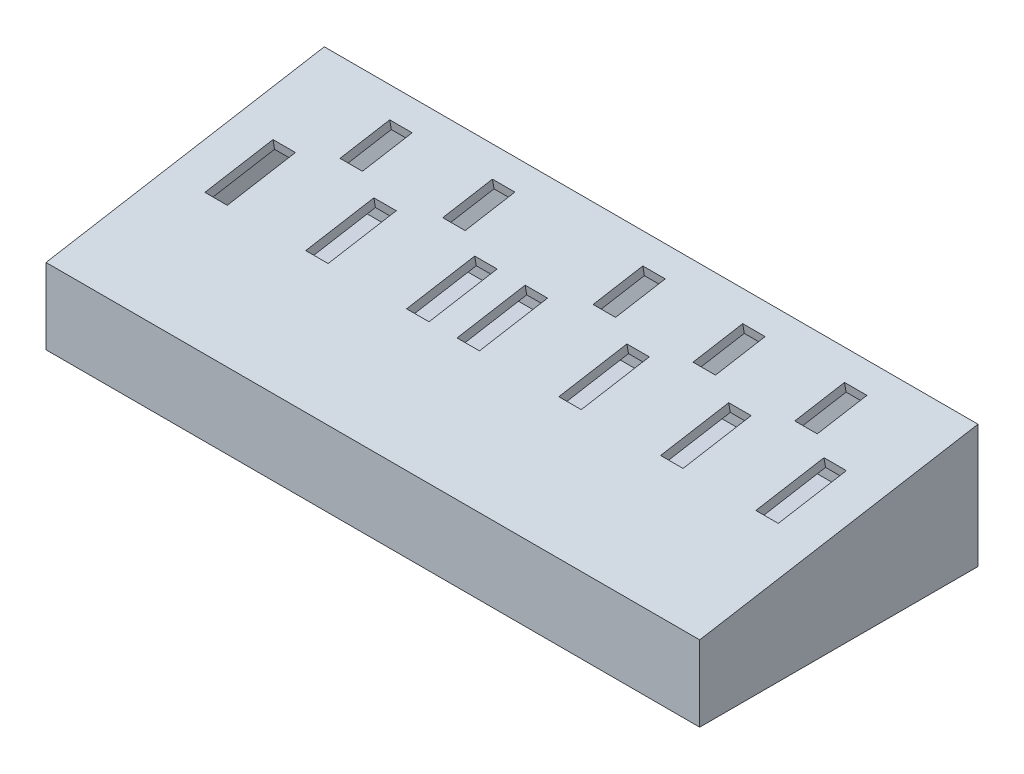
from build123d import *

# Parameters (mm, degrees)
CROQUIS1_W              = 700
CROQUIS1_H              = 298
SALIENTE_EXTRUIR1_DEPTH = 132
CORTAR_EXTRUIR1_DEPTH   = 773.158014917
CROQUIS5_W              = 24
CROQUIS5_H              = 74
CROQUIS5_H_2            = 54
CORTAR_EXTRUIR2_DEPTH   = 10
VACIADO2_START          = 10
VACIADO2_DEPTH          = 680


# Read off the part's stored shape, not the designer's step: Vaciado2
with BuildPart() as part:
    # Croquis1 → Saliente-Extruir1 (new body)
    with BuildSketch(Plane(origin=(0, 0, 0), x_dir=(1, 0, 0), z_dir=(0, 1, 0))):
        with Locations((350, 149)):
            Rectangle(CROQUIS1_W, CROQUIS1_H)
    extrude(amount=SALIENTE_EXTRUIR1_DEPTH)

    # Croquis3 → Cortar-Extruir1 (cut, through all)
    with BuildSketch(Plane.ZY):
        Polygon((0, 81), (-298, 132), (0, 132), align=None)
    extrude(amount=-CORTAR_EXTRUIR1_DEPTH, mode=Mode.SUBTRACT)

    # Croquis5 → Cortar-Extruir2 (cut)
    with BuildSketch(Plane(origin=(0, 78.695082326, 13.467950331), x_dir=(1, 0, 0), z_dir=(0, 0.9856694305119892, 0.16868839247017262))):
        with Locations((54, 180.66375979)):
            Rectangle(CROQUIS5_W, CROQUIS5_H)
        with Locations((162, 180.66375979)):
            Rectangle(CROQUIS5_W, CROQUIS5_H)
        with Locations((270, 180.66375979)):
            Rectangle(CROQUIS5_W, CROQUIS5_H)
        with Locations((324, 180.66375979)):
            Rectangle(CROQUIS5_W, CROQUIS5_H)
        with Locations((433, 180.66375979)):
            Rectangle(CROQUIS5_W, CROQUIS5_H)
        with Locations((542, 180.66375979)):
            Rectangle(CROQUIS5_W, CROQUIS5_H)
        with Locations((644, 180.66375979)):
            Rectangle(CROQUIS5_W, CROQUIS5_H)
        with Locations((110, 260.66375979)):
            Rectangle(CROQUIS5_W, CROQUIS5_H_2)
        with Locations((220, 260.66375979)):
            Rectangle(CROQUIS5_W, CROQUIS5_H_2)
        with Locations((381, 260.66375979)):
            Rectangle(CROQUIS5_W, CROQUIS5_H_2)
        with Locations((488, 260.66375979)):
            Rectangle(CROQUIS5_W, CROQUIS5_H_2)
        with Locations((597, 260.66375979)):
            Rectangle(CROQUIS5_W, CROQUIS5_H_2)
    extrude(amount=-CORTAR_EXTRUIR2_DEPTH, mode=Mode.SUBTRACT)

    # Vaciado2 outline → Vaciado2 (cut)
    with BuildSketch(Plane.YZ.offset(VACIADO2_START)):
        Polygon((93.072796716, -129.823909891), (72.566020191, -10), (10, -10), (10, -288), (120.143201399, -288), (117.363925232, -271.760307885), (108.254752038, -218.534158637), (105.555737759, -202.763447749), align=None)
    extrude(amount=VACIADO2_DEPTH, mode=Mode.SUBTRACT)


solid = part.part
